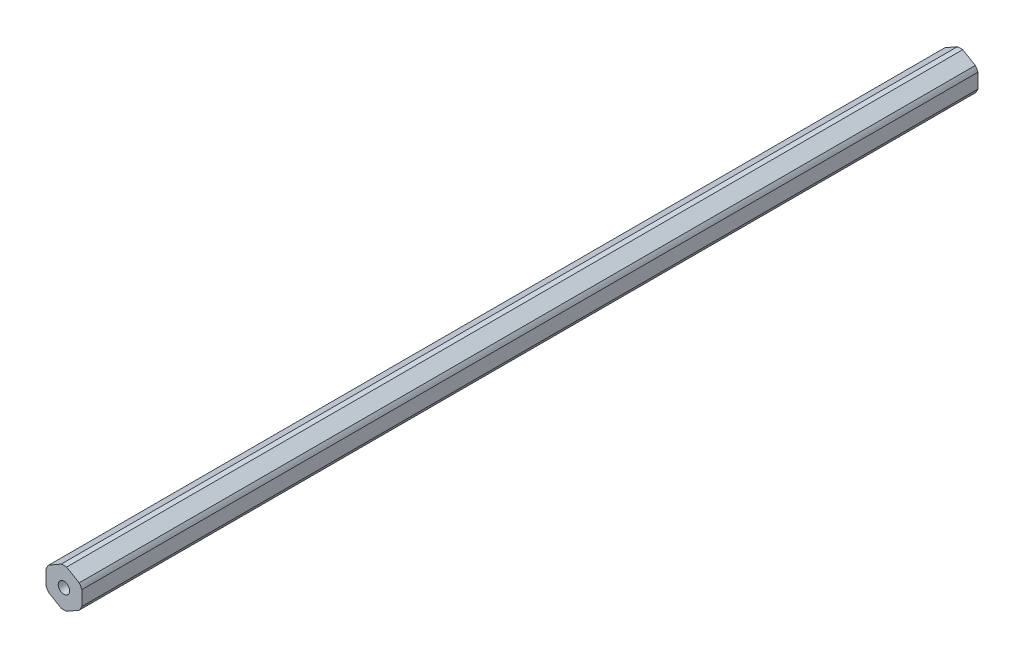
from build123d import *

# Parameters (mm, degrees)
BOSS_EXTRUDE1_DEPTH = 158.8516
SKETCH2_R           = 2.0193
CUT_EXTRUDE1_DEPTH  = 318.840648681


with BuildPart() as part:
    # Sketch1 → Boss-Extrude1 (new, symmetric)
    with BuildSketch(Plane.XY):
        with BuildLine():
            ThreePointArc((6.35, 2.590301913), (5.939202219, 3.429), (5.41826726, 4.204110358))
            Line((5.41826726, 4.204110358), (0.93173274, 6.79441227))
            ThreePointArc((0.93173274, 6.79441227), (0, 6.858), (-0.93173274, 6.79441227))
            Line((-0.93173274, 6.79441227), (-5.41826726, 4.204110358))
            ThreePointArc((-5.41826726, 4.204110358), (-5.939202219, 3.429), (-6.35, 2.590301913))
            Line((-6.35, 2.590301913), (-6.35, -2.590301913))
            ThreePointArc((-6.35, -2.590301913), (-5.939202219, -3.429), (-5.41826726, -4.204110358))
            Line((-5.41826726, -4.204110358), (-0.93173274, -6.79441227))
            ThreePointArc((-0.93173274, -6.79441227), (0, -6.858), (0.93173274, -6.79441227))
            Line((0.93173274, -6.79441227), (5.41826726, -4.204110358))
            ThreePointArc((5.41826726, -4.204110358), (5.939202219, -3.429), (6.35, -2.590301913))
            Line((6.35, -2.590301913), (6.35, 2.590301913))
        make_face()
    extrude(amount=BOSS_EXTRUDE1_DEPTH, both=True)

    # Sketch2 → Cut-Extrude1 (cut, through all)
    with BuildSketch(Plane.XY.offset(158.8516)):
        Circle(SKETCH2_R)
    extrude(amount=-CUT_EXTRUDE1_DEPTH, mode=Mode.SUBTRACT)


solid = part.part
